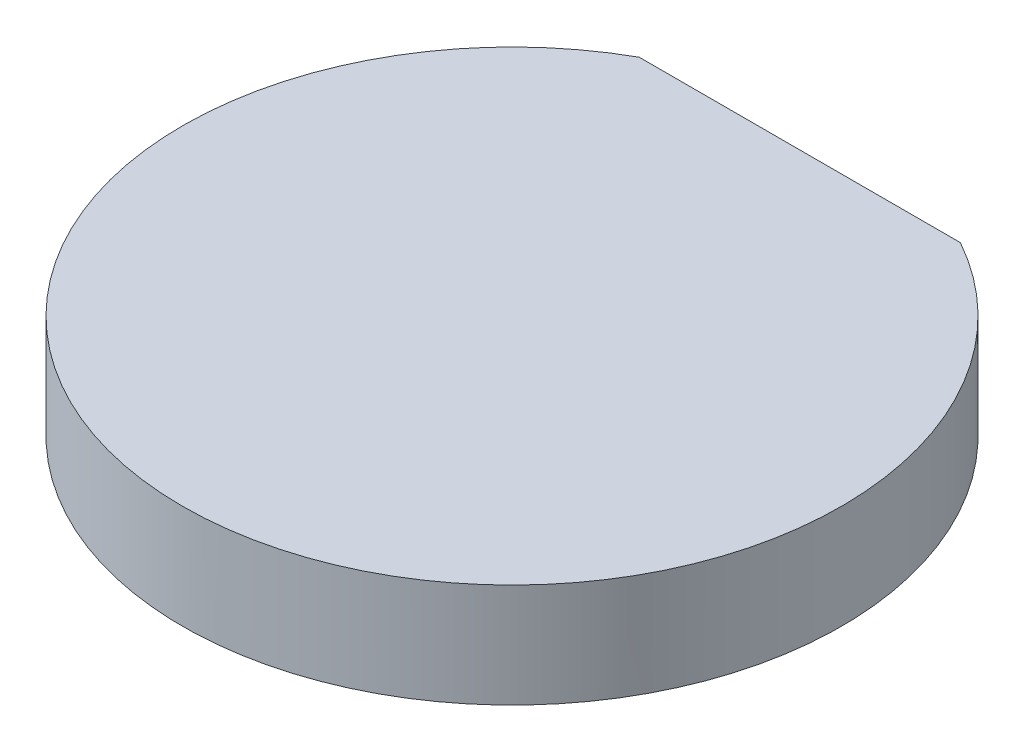
from build123d import *

# Parameters (mm, degrees)
SKETCH1_R           = 35.5
BOSS_EXTRUDE1_DEPTH = 2
SKETCH2_R           = 35.5
SKETCH2_R_2         = 34
BOSS_EXTRUDE2_DEPTH = 9.2
SKETCH5_R           = 34
SKETCH5_R_2         = 28.75
BOSS_EXTRUDE3_DEPTH = 1.5
CUT_EXTRUDE2_REACH  = 59.253
CUT_EXTRUDE3_REACH  = 55.534


with BuildPart() as part:
    # Sketch1 → Boss-Extrude1 (new body)
    with BuildSketch(Plane.XZ):
        with Locations((0, -8)):
            Circle(SKETCH1_R)
    extrude(amount=BOSS_EXTRUDE1_DEPTH)

    # Sketch2 → Boss-Extrude2 (add)
    with BuildSketch(Plane.XZ.offset(2)):
        with Locations((0, -8)):
            Circle(SKETCH2_R)
        with Locations((0, -8)):
            Circle(SKETCH2_R_2, mode=Mode.SUBTRACT)
    extrude(amount=BOSS_EXTRUDE2_DEPTH)

    # Sketch5 → Boss-Extrude3 (add)
    with BuildSketch(Plane.XZ.offset(2)):
        with Locations((0, -8)):
            Circle(SKETCH5_R)
        with Locations((0, -8)):
            Circle(SKETCH5_R_2, mode=Mode.SUBTRACT)
    extrude(amount=BOSS_EXTRUDE3_DEPTH)

    # Sketch3 → Cut-Extrude2 (cut, up to next)
    with BuildSketch(Plane(origin=(0, 0, 0), x_dir=(1, 0, 0), z_dir=(0, 1, 0)), mode=Mode.PRIVATE) as cut_extrude2_sk1:
        with BuildLine():
            Line((-17.298843892, 39), (17.298843892, 39))
            ThreePointArc((17.298843892, 39), (0, 43.5), (-17.298843892, 39))
        make_face()
    cut_extrude2_tool1 = extrude(cut_extrude2_sk1.sketch, amount=-CUT_EXTRUDE2_REACH, mode=Mode.PRIVATE) & part.part
    add(cut_extrude2_tool1.solids().sort_by_distance((0, 0, -40.810151))[0], mode=Mode.SUBTRACT)

    # Sketch6 → Cut-Extrude3 (cut, up to next)
    with BuildSketch(Plane.XZ.offset(2), mode=Mode.PRIVATE) as cut_extrude3_sk1:
        Polygon((-18.869547058, -39), (-16, -31.886450134), (16, -31.886450134), (18.869547058, -39), align=None)
    cut_extrude3_tool1 = extrude(cut_extrude3_sk1.sketch, amount=CUT_EXTRUDE3_REACH, mode=Mode.PRIVATE) & part.part
    add(cut_extrude3_tool1.solids().sort_by_distance((0, -2, -35.540792))[0], mode=Mode.SUBTRACT)


solid = part.part
